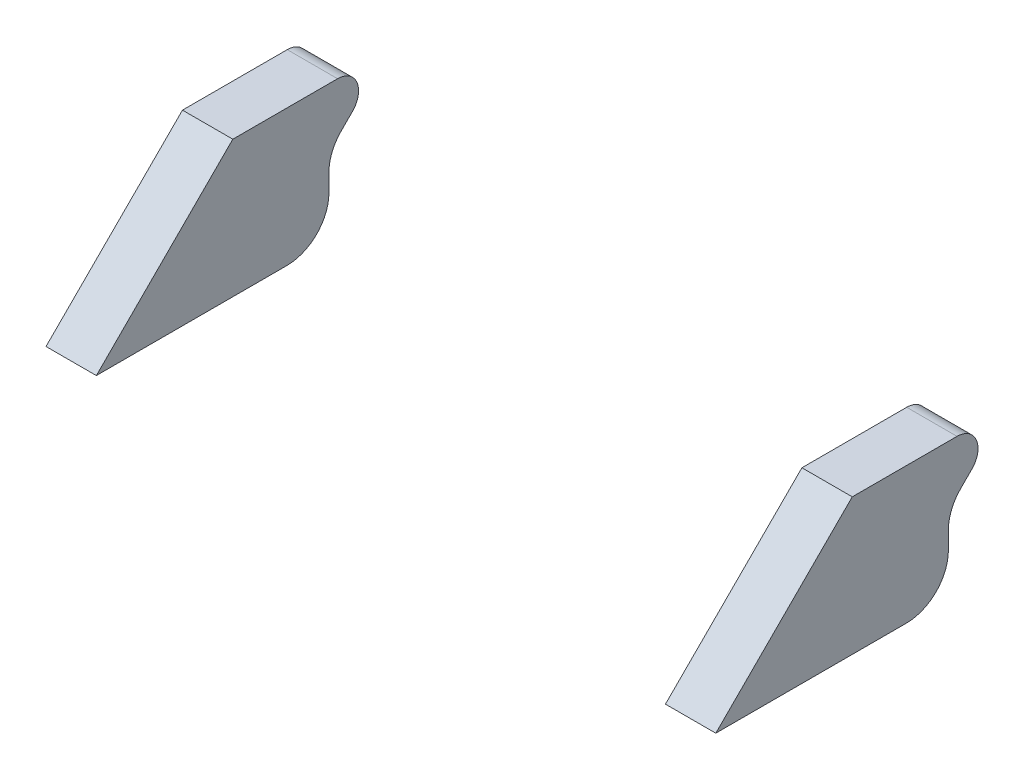
from build123d import *

# Parameters (mm, degrees)
BOSS_EXTRUDE2_DEPTH = 7.62


with BuildPart() as part:
    # Sketch5 → Boss-Extrude2 (new body)
    with BuildSketch(Plane(origin=(-50.684999952, 0, 0), x_dir=(0, 0, -1), z_dir=(1, 0, 0))):
        with BuildLine():
            Line((-182.584702864, -7.784224952), (-184.280349852, -9.479871939))
            ThreePointArc((-184.280349852, -9.479871939), (-185.656856823, -11.539960204), (-186.140221791, -13.97))
            Line((-186.140221791, -13.97), (-186.140221791, -16.66875))
            ThreePointArc((-186.140221791, -16.66875), (-188.000093731, -21.158878061), (-192.490221791, -23.01875))
            Line((-192.490221791, -23.01875), (-221.341334172, -23.01875))
            Line((-221.341334172, -23.01875), (-200.686745093, -2.364160922))
            Line((-200.686745093, -2.364160922), (-184.829766894, -2.364160922))
            ThreePointArc((-184.829766894, -2.364160922), (-181.896449379, -4.324141024), (-182.584702864, -7.784224952))
        make_face()
    extrude(amount=BOSS_EXTRUDE2_DEPTH)


with BuildPart() as body_2:
    # Mirror2: mirrored copy
    add(part.part.mirror(Plane(origin=(0, 0, 0), x_dir=(0, 0, 1), z_dir=(1, 0, 0))))


solid = Compound([part.part, body_2.part])
